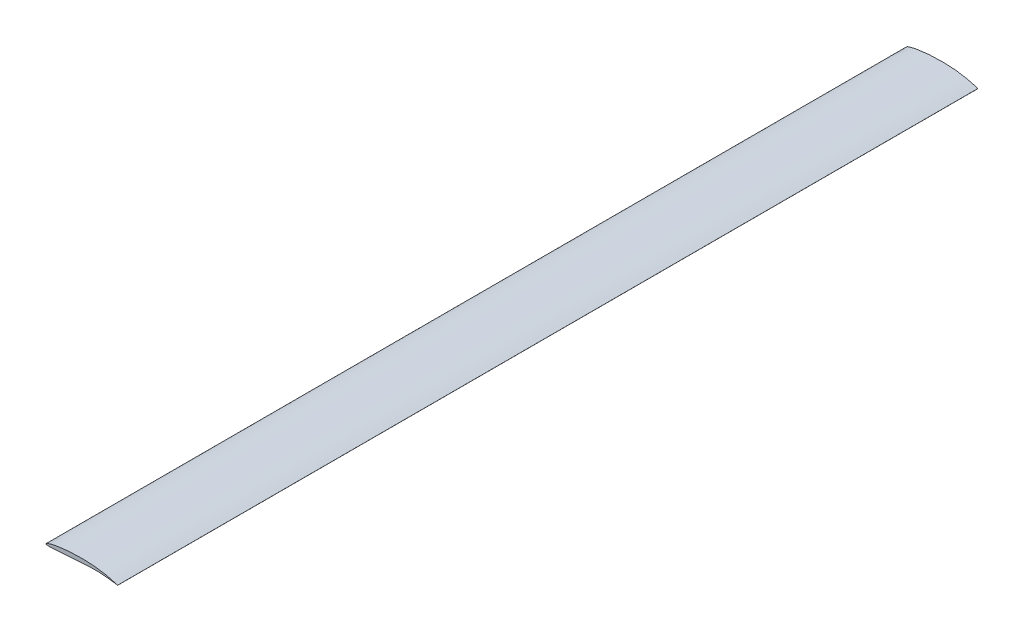
from build123d import *

# Parameters (mm, degrees)
BOSS_EXTRUDE1_DEPTH = 1584.96


with BuildPart() as part:
    # Sketch4 → Boss-Extrude1 (new body)
    with BuildSketch(Plane.XY):
        with BuildLine():
            Line((132.08, 0.0832104), (132.08, -0.0832104))
            add(Edge.make_bspline(
                [(132.08, 0.0832104), (131.763127316, 0.184171123), (130.879147452, 0.465821297), (129.274234404, 0.963499685), (127.150982738, 1.600907901), (123.675002407, 2.600598406), (117.598197603, 4.215104314), (111.122208862, 5.666569678), (104.100212611, 6.988381294), (99.161277178, 7.776191332), (94.130735153, 8.430165975), (90.291149528, 8.852325972), (86.423516656, 9.198412187), (82.540339777, 9.468018776), (78.652608547, 9.650252564), (74.772586359, 9.780433194), (70.909993434, 9.871089577), (65.821749319, 9.933717492), (60.786839849, 9.912520229), (54.625911654, 9.779868088), (49.819437096, 9.59323767), (45.111781395, 9.324718688), (41.700767917, 9.088381149), (38.380406532, 8.816939101), (35.157431028, 8.512442797), (32.038347722, 8.177316528), (29.029498227, 7.81401289), (26.137021383, 7.425359485), (23.366908227, 7.014241438), (20.724973999, 6.583776629), (18.216906547, 6.1371654), (15.848230898, 5.677813139), (13.624360425, 5.209095685), (11.550575478, 4.734491281), (9.632009701, 4.257546015), (7.873707708, 3.781700585), (6.280559433, 3.3104137), (4.857320628, 2.847058667), (3.608584585, 2.394810908), (2.53862296, 1.956933205), (1.651406481, 1.53598092), (0.949628301, 1.1353948), (0.434675847, 0.753987467), (0.101423034, 0.392726715), (-0.04179329, 0.012047049), (0.089831697, -0.35238928), (0.441568533, -0.613187031), (0.957887254, -0.822863597), (1.660725495, -0.992579716), (2.54696211, -1.124497171), (3.616263059, -1.218909006), (4.864266153, -1.276492526), (6.28691087, -1.298262992), (7.879541859, -1.285437629), (9.637401796, -1.239419156), (11.555569864, -1.16186709), (13.628997861, -1.05450376), (15.852530638, -0.919321153), (18.220875028, -0.758330283), (20.728626208, -0.573853796), (23.370237394, -0.368186961), (26.14002727, -0.143859291), (29.032174713, 0.09650887), (32.040695555, 0.350190501), (35.159442158, 0.614379165), (38.382083395, 0.886223752), (41.702112629, 1.16272566), (45.112797046, 1.441033284), (49.820829647, 1.814415091), (55.877956604, 2.268647568), (62.03866241, 2.68367318), (67.073527883, 2.988131306), (70.909074846, 3.201301582), (74.771517177, 3.394983415), (78.650799007, 3.570958592), (82.537040598, 3.714821991), (86.420044734, 3.78899784), (90.287417694, 3.802266766), (94.126839453, 3.752826034), (99.151923806, 3.607370045), (105.253522287, 3.285931719), (112.26502676, 2.701616284), (117.798491763, 2.08178154), (121.90322799, 1.540162391), (124.666486174, 1.142238002), (127.148784115, 0.757700328), (129.272712479, 0.408007467), (130.87831917, 0.131501366), (131.763076401, -0.026583695), (132.08, -0.0832104)],
                knots=[0, 0, 0, 0, 0.003728993, 0.010402774, 0.018840568, 0.028585709, 0.050956865, 0.089334271, 0.10297657, 0.131071145, 0.145402462, 0.159853793, 0.174379924, 0.188939766, 0.203496108, 0.218017346, 0.232469302, 0.246817477, 0.275073667, 0.28892109, 0.315912882, 0.329003977, 0.341791348, 0.354250441, 0.366357575, 0.378089701, 0.389424235, 0.400339091, 0.410812773, 0.420824001, 0.430352033, 0.439376412, 0.447877061, 0.455834383, 0.463229144, 0.470042802, 0.476257372, 0.481856009, 0.486823221, 0.491145842, 0.494814445, 0.497826693, 0.500195359, 0.501969932, 0.50330007, 0.504508604, 0.506012742, 0.508062771, 0.510747122, 0.514093105, 0.518105083, 0.522777318, 0.528099107, 0.534056683, 0.540634481, 0.547815449, 0.555581622, 0.563914059, 0.572793129, 0.582198376, 0.592108707, 0.602502417, 0.613356987, 0.624649417, 0.636355909, 0.648451947, 0.660912408, 0.673711425, 0.68682217, 0.713868083, 0.741818751, 0.756056506, 0.770425669, 0.784891946, 0.799419294, 0.813967731, 0.828495783, 0.842964095, 0.857330143, 0.871547876, 0.89933031, 0.925831588, 0.950429236, 0.961757467, 0.972254714, 0.981731905, 0.989922338, 0.996390141, 1, 1, 1, 1], degree=3))
        make_face()
    extrude(amount=BOSS_EXTRUDE1_DEPTH)


solid = part.part
